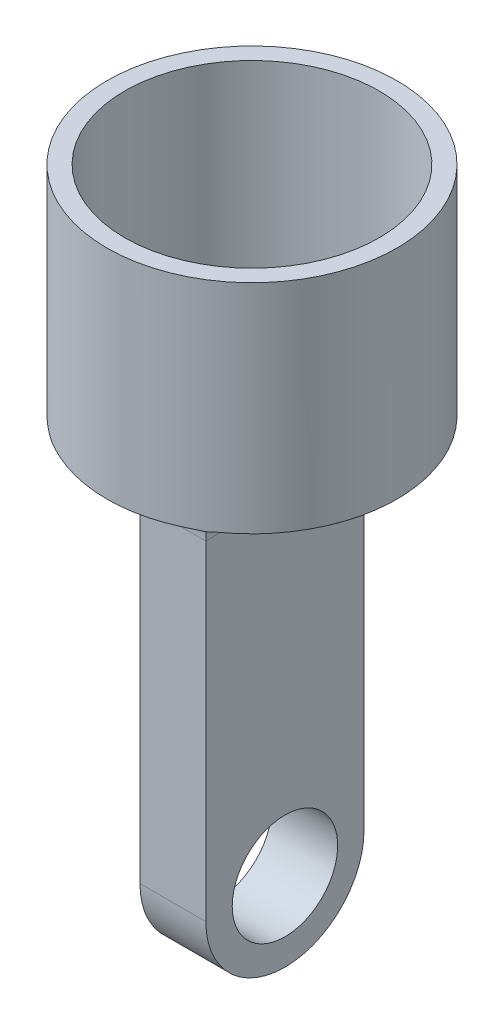
from build123d import *

# Parameters (mm, degrees)
SKETCH1_R           = 11
SKETCH1_R_2         = 9.652
BOSS_EXTRUDE1_DEPTH = 15
BOSS_EXTRUDE2_START = 1.5
SKETCH2_R           = 11
BOSS_EXTRUDE2_DEPTH = 1.5
SKETCH4_W           = 5
SKETCH4_H           = 12
BOSS_EXTRUDE4_DEPTH = 35
SKETCH5_R           = 4
CUT_EXTRUDE1_DEPTH  = 5
CUT_EXTRUDE2_DEPTH  = 41.441315508
FILLET1_R           = 4


with BuildPart() as part:
    # Sketch1 → Boss-Extrude1 (new body)
    with BuildSketch(Plane(origin=(0, 0, 0), x_dir=(1, 0, 0), z_dir=(0, 1, 0))):
        with Locations(Location((0, 0, 0), (0, 0, 270))):
            Circle(SKETCH1_R)
        with Locations(Location((0, 0, 0), (0, 0, 270))):
            Circle(SKETCH1_R_2, mode=Mode.SUBTRACT)
    extrude(amount=BOSS_EXTRUDE1_DEPTH)

    # Sketch2 → Boss-Extrude2 (add)
    with BuildSketch(Plane.XZ.offset(BOSS_EXTRUDE2_START)):
        with Locations(Location((0, 0, 0), (0, 0, 270))):
            Circle(SKETCH2_R)
    extrude(amount=-BOSS_EXTRUDE2_DEPTH)

    # Sketch4 → Boss-Extrude4 (add)
    with BuildSketch(Plane.XZ.offset(1.5)):
        Rectangle(SKETCH4_W, SKETCH4_H)
    extrude(amount=BOSS_EXTRUDE4_DEPTH)

    # Sketch5 → Cut-Extrude1 (cut)
    with BuildSketch(Plane.ZY.offset(2.5)):
        with Locations((0, -30.5)):
            Circle(SKETCH5_R)
    extrude(amount=-CUT_EXTRUDE1_DEPTH, mode=Mode.SUBTRACT)

    # Sketch6 → Cut-Extrude2 (cut, through all)
    with BuildSketch(Plane.ZY.offset(2.5)):
        with BuildLine():
            Line((-6, -30.5), (-6, -36.5))
            ThreePointArc((-6, -36.5), (0, -38.985281374), (6, -36.5))
            Line((6, -36.5), (6, -30.5))
            ThreePointArc((6, -30.5), (0, -36.5), (-6, -30.5))
        make_face()
    extrude(amount=-CUT_EXTRUDE2_DEPTH, mode=Mode.SUBTRACT)

    # Fillet1
    # the kernel refuses this fillet: 4 mm, written as the material it adds along each edge
    with BuildSketch(Plane(origin=(2.5, -1.5, -6), x_dir=(1, 0, 0), z_dir=(0, 0, 1)), Plane(origin=(-2.5, -1.5, 6), x_dir=(-1, 0, 0), z_dir=(0, 0, -1))) as fillet1_piece_1:
        with BuildLine():
            CenterArc((FILLET1_R, -FILLET1_R), FILLET1_R, 90, 90)
            Line((0, -FILLET1_R), (0, 0))
            Line((0, 0), (FILLET1_R, 0))
        make_face()
    extrude(amount=12)
    with BuildSketch(Plane(origin=(2.5, -1.5, 6), x_dir=(0, 0, 1), z_dir=(-1, 0, 0)), Plane(origin=(-2.5, -1.5, -6), x_dir=(0, 0, -1), z_dir=(1, 0, 0))) as fillet1_piece_2:
        with BuildLine():
            CenterArc((FILLET1_R, -FILLET1_R), FILLET1_R, 90, 90)
            Line((0, -FILLET1_R), (0, 0))
            Line((0, 0), (FILLET1_R, 0))
        make_face()
    extrude(amount=5)
    with BuildSketch(Plane(origin=(-2.5, -1.5, -6), x_dir=(0, 0, -1), z_dir=(1, 0, 0))) as fillet1_piece_3a_section:
        with BuildLine():
            CenterArc((FILLET1_R, -FILLET1_R), FILLET1_R, 90, 90)
            Line((0, -FILLET1_R), (0, 0))
            Line((0, 0), (FILLET1_R, 0))
        make_face()
    fillet1_piece_3a = extrude(amount=15, mode=Mode.PRIVATE)
    fillet1_piece_3a = fillet1_piece_3a & Plane(origin=(0, -2.470762695, 0), x_dir=(0, 0, -1), z_dir=(0, -1, 0)) * Cylinder(11, 46, mode=Mode.PRIVATE)
    fillet1_piece_3a = split(fillet1_piece_3a, bisect_by=Plane(origin=(2.5, -2.470762695, -6.788618782), z_dir=(1, 0, 0)), keep=Keep.TOP, mode=Mode.PRIVATE)
    with BuildSketch(Plane(origin=(2.5, -1.5, -16), x_dir=(1, 0, 0), z_dir=(0, 0, 1))) as fillet1_piece_3b_section:
        with BuildLine():
            CenterArc((FILLET1_R, -FILLET1_R), FILLET1_R, 90, 90)
            Line((0, -FILLET1_R), (0, 0))
            Line((0, 0), (FILLET1_R, 0))
        make_face()
    fillet1_piece_3b = extrude(amount=22, mode=Mode.PRIVATE)
    fillet1_piece_3b = fillet1_piece_3b & Plane(origin=(0, -2.441237168, 0), x_dir=(0, 0, -1), z_dir=(0, -1, 0)) * Cylinder(11, 60, mode=Mode.PRIVATE)
    fillet1_piece_3b = split(fillet1_piece_3b, bisect_by=Plane(origin=(3.34113706, -2.441237168, -6), z_dir=(0, 0, -1)), keep=Keep.TOP, mode=Mode.PRIVATE)
    fillet1_piece_3 = fillet1_piece_3a & fillet1_piece_3b
    add(fillet1_piece_3)
    with BuildSketch(Plane(origin=(2.5, -1.5, -6), x_dir=(1, 0, 0), z_dir=(0, 0, 1))) as fillet1_piece_4a_section:
        with BuildLine():
            CenterArc((FILLET1_R, -FILLET1_R), FILLET1_R, 90, 90)
            Line((0, -FILLET1_R), (0, 0))
            Line((0, 0), (FILLET1_R, 0))
        make_face()
    fillet1_piece_4a = extrude(amount=22, mode=Mode.PRIVATE)
    fillet1_piece_4a = fillet1_piece_4a & Plane(origin=(0, -2.441236356, 0), x_dir=(0, 0, -1), z_dir=(0, -1, 0)) * Cylinder(11, 60, mode=Mode.PRIVATE)
    fillet1_piece_4a = split(fillet1_piece_4a, bisect_by=Plane(origin=(3.341136574, -2.441236356, 6), z_dir=(0, 0, 1)), keep=Keep.TOP, mode=Mode.PRIVATE)
    with BuildSketch(Plane(origin=(12.5, -1.5, 6), x_dir=(0, 0, 1), z_dir=(-1, 0, 0))) as fillet1_piece_4b_section:
        with BuildLine():
            CenterArc((FILLET1_R, -FILLET1_R), FILLET1_R, 90, 90)
            Line((0, -FILLET1_R), (0, 0))
            Line((0, 0), (FILLET1_R, 0))
        make_face()
    fillet1_piece_4b = extrude(amount=15, mode=Mode.PRIVATE)
    fillet1_piece_4b = fillet1_piece_4b & Plane(origin=(0, -2.470761842, 0), x_dir=(0, 0, -1), z_dir=(0, -1, 0)) * Cylinder(11, 46, mode=Mode.PRIVATE)
    fillet1_piece_4b = split(fillet1_piece_4b, bisect_by=Plane(origin=(2.5, -2.470761842, 6.78861866), z_dir=(1, 0, 0)), keep=Keep.TOP, mode=Mode.PRIVATE)
    fillet1_piece_4 = fillet1_piece_4a & fillet1_piece_4b
    add(fillet1_piece_4)
    with BuildSketch(Plane(origin=(2.5, -1.5, 6), x_dir=(0, 0, 1), z_dir=(-1, 0, 0))) as fillet1_piece_5a_section:
        with BuildLine():
            CenterArc((FILLET1_R, -FILLET1_R), FILLET1_R, 90, 90)
            Line((0, -FILLET1_R), (0, 0))
            Line((0, 0), (FILLET1_R, 0))
        make_face()
    fillet1_piece_5a = extrude(amount=15, mode=Mode.PRIVATE)
    fillet1_piece_5a = fillet1_piece_5a & Plane(origin=(0, -2.470762695, 0), x_dir=(0, 0, -1), z_dir=(0, -1, 0)) * Cylinder(11, 46, mode=Mode.PRIVATE)
    fillet1_piece_5a = split(fillet1_piece_5a, bisect_by=Plane(origin=(-2.5, -2.470762695, 6.788618782), z_dir=(-1, 0, 0)), keep=Keep.TOP, mode=Mode.PRIVATE)
    with BuildSketch(Plane(origin=(-2.5, -1.5, 16), x_dir=(-1, 0, 0), z_dir=(0, 0, -1))) as fillet1_piece_5b_section:
        with BuildLine():
            CenterArc((FILLET1_R, -FILLET1_R), FILLET1_R, 90, 90)
            Line((0, -FILLET1_R), (0, 0))
            Line((0, 0), (FILLET1_R, 0))
        make_face()
    fillet1_piece_5b = extrude(amount=22, mode=Mode.PRIVATE)
    fillet1_piece_5b = fillet1_piece_5b & Plane(origin=(0, -2.441237168, 0), x_dir=(0, 0, -1), z_dir=(0, -1, 0)) * Cylinder(11, 60, mode=Mode.PRIVATE)
    fillet1_piece_5b = split(fillet1_piece_5b, bisect_by=Plane(origin=(-3.34113706, -2.441237168, 6), z_dir=(0, 0, 1)), keep=Keep.TOP, mode=Mode.PRIVATE)
    fillet1_piece_5 = fillet1_piece_5a & fillet1_piece_5b
    add(fillet1_piece_5)
    with BuildSketch(Plane(origin=(-12.5, -1.5, -6), x_dir=(0, 0, -1), z_dir=(1, 0, 0))) as fillet1_piece_6a_section:
        with BuildLine():
            CenterArc((FILLET1_R, -FILLET1_R), FILLET1_R, 90, 90)
            Line((0, -FILLET1_R), (0, 0))
            Line((0, 0), (FILLET1_R, 0))
        make_face()
    fillet1_piece_6a = extrude(amount=15, mode=Mode.PRIVATE)
    fillet1_piece_6a = fillet1_piece_6a & Plane(origin=(0, -2.470761842, 0), x_dir=(0, 0, -1), z_dir=(0, -1, 0)) * Cylinder(11, 46, mode=Mode.PRIVATE)
    fillet1_piece_6a = split(fillet1_piece_6a, bisect_by=Plane(origin=(-2.5, -2.470761842, -6.788618661), z_dir=(-1, 0, 0)), keep=Keep.TOP, mode=Mode.PRIVATE)
    with BuildSketch(Plane(origin=(-2.5, -1.5, 6), x_dir=(-1, 0, 0), z_dir=(0, 0, -1))) as fillet1_piece_6b_section:
        with BuildLine():
            CenterArc((FILLET1_R, -FILLET1_R), FILLET1_R, 90, 90)
            Line((0, -FILLET1_R), (0, 0))
            Line((0, 0), (FILLET1_R, 0))
        make_face()
    fillet1_piece_6b = extrude(amount=22, mode=Mode.PRIVATE)
    fillet1_piece_6b = fillet1_piece_6b & Plane(origin=(0, -2.441236356, 0), x_dir=(0, 0, -1), z_dir=(0, -1, 0)) * Cylinder(11, 60, mode=Mode.PRIVATE)
    fillet1_piece_6b = split(fillet1_piece_6b, bisect_by=Plane(origin=(-3.341136574, -2.441236356, -6), z_dir=(0, 0, -1)), keep=Keep.TOP, mode=Mode.PRIVATE)
    fillet1_piece_6 = fillet1_piece_6a & fillet1_piece_6b
    add(fillet1_piece_6)


solid = part.part
